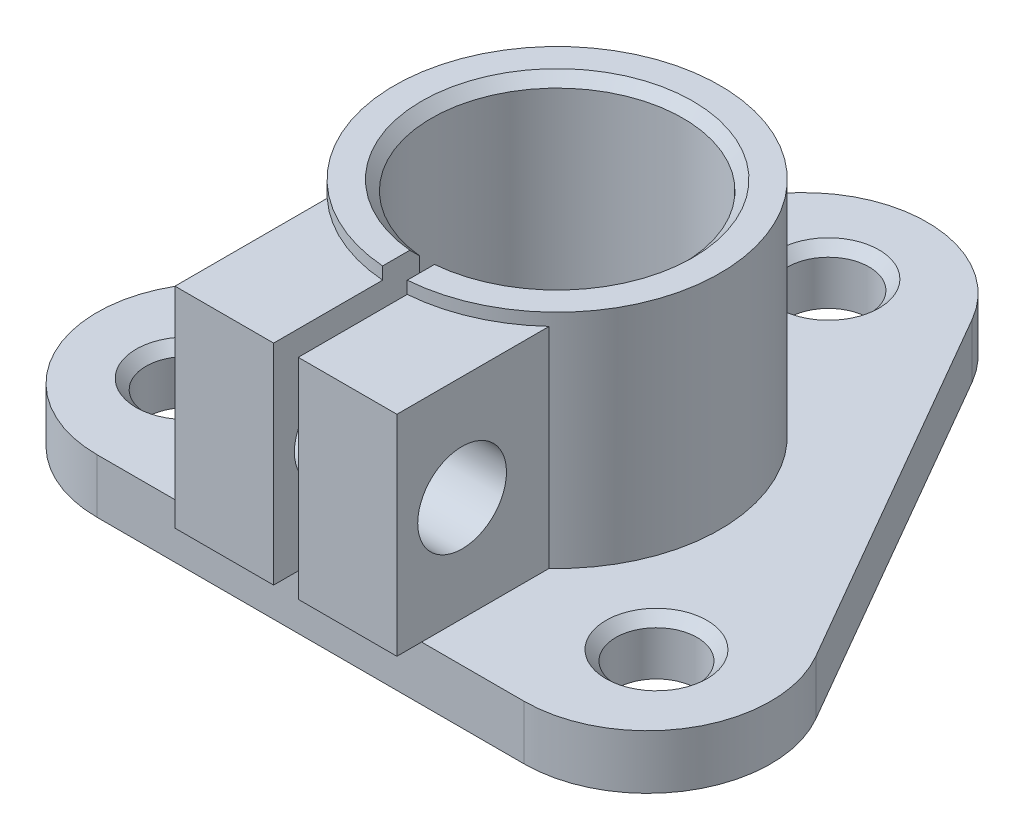
from build123d import *

# Parameters (mm, degrees)
EXTRUDE_1_DEPTH             = 2.2
CUT_EXTRUDE_2_REACH         = 28.549
SKETCH_4_R                  = 1.65
CUT_EXTRUDE_3_REACH         = 28.549
SKETCH_2_R                  = 5.1
EXTRUDE_START               = 9
SKETCH_5_R                  = 6.6
SKETCH_5_R_2                = 5.1
EXTRUDE_1_2_DEPTH           = 9
FILLET_1_R                  = 5
SKETCH_6_W                  = 1
SKETCH_6_H                  = 6.6
CUT_EXTRUDE_1_DEPTH         = 10
EXTRUDE_2_REACH             = 32.611
SKETCH_7_W                  = 4
SKETCH_7_H                  = 8.5
EXTRUDE_2_DIRECTION_2_DEPTH = 1
SKETCH_8_R                  = 1.8
CUT_EXTRUDE_4_DEPTH         = 27.081311829
CHAMFER_1_SIZE              = 0.4


with BuildPart() as part:
    # 草图1 → Extrude 1 (new body)
    with BuildSketch(Plane(origin=(0, 0, 0), x_dir=(1, 0, 0), z_dir=(0, 1, 0))):
        Polygon((17.320508076, -10), (0, 20), (-17.320508076, -10), align=None)
    extrude(amount=EXTRUDE_1_DEPTH)

    # 草图4 → 切除-拉伸2 (cut, up to next)
    with BuildSketch(Plane(origin=(0, 2.2, 0), x_dir=(1, 0, 0), z_dir=(0, 1, 0)), mode=Mode.PRIVATE) as cut_extrude_2_sk1:
        with Locations((0, 11)):
            Circle(SKETCH_4_R)
    cut_extrude_2_tool1 = extrude(cut_extrude_2_sk1.sketch, amount=-CUT_EXTRUDE_2_REACH, mode=Mode.PRIVATE) & part.part
    # 草图4 → 切除-拉伸2 (cut, up to next)
    with BuildSketch(Plane(origin=(0, 2.2, 0), x_dir=(1, 0, 0), z_dir=(0, 1, 0)), mode=Mode.PRIVATE) as cut_extrude_2_sk2:
        with Locations((9.526279442, -5.5)):
            Circle(SKETCH_4_R)
    cut_extrude_2_tool2 = extrude(cut_extrude_2_sk2.sketch, amount=-CUT_EXTRUDE_2_REACH, mode=Mode.PRIVATE) & part.part
    # 草图4 → 切除-拉伸2 (cut, up to next)
    with BuildSketch(Plane(origin=(0, 2.2, 0), x_dir=(1, 0, 0), z_dir=(0, 1, 0)), mode=Mode.PRIVATE) as cut_extrude_2_sk3:
        with Locations((-9.526279442, -5.5)):
            Circle(SKETCH_4_R)
    cut_extrude_2_tool3 = extrude(cut_extrude_2_sk3.sketch, amount=-CUT_EXTRUDE_2_REACH, mode=Mode.PRIVATE) & part.part
    add(cut_extrude_2_tool1.solids().sort_by_distance((0, 2.2, -11))[0], mode=Mode.SUBTRACT)
    add(cut_extrude_2_tool2.solids().sort_by_distance((9.526279, 2.2, 5.5))[0], mode=Mode.SUBTRACT)
    add(cut_extrude_2_tool3.solids().sort_by_distance((-9.526279, 2.2, 5.5))[0], mode=Mode.SUBTRACT)

    # 草图2 → 切除-拉伸3 (cut, up to next)
    with BuildSketch(Plane(origin=(0, 2.2, 0), x_dir=(1, 0, 0), z_dir=(0, 1, 0)), mode=Mode.PRIVATE) as cut_extrude_3_sk1:
        Circle(SKETCH_2_R)
    cut_extrude_3_tool1 = extrude(cut_extrude_3_sk1.sketch, amount=-CUT_EXTRUDE_3_REACH, mode=Mode.PRIVATE) & part.part
    add(cut_extrude_3_tool1.solids().sort_by_distance((0, 2.2, 0))[0], mode=Mode.SUBTRACT)

    # 草图5 → Extrude 1 2 (add)
    with BuildSketch(Plane(origin=(0, 2.2, 0), x_dir=(1, 0, 0), z_dir=(0, 1, 0)).offset(EXTRUDE_START)):
        Circle(SKETCH_5_R)
        Circle(SKETCH_5_R_2, mode=Mode.SUBTRACT)
    extrude(amount=-EXTRUDE_1_2_DEPTH)

    # 圆角1
    fillet_1_edges = [part.edges().sort_by_distance(p)[0] for p in [
        (17.320508076, 1.1, 10),
        (-17.320508076, 1.1, 10),
        (0, 1.1, -20),
    ]]
    fillet(fillet_1_edges, radius=FILLET_1_R)

    # 草图6 → 切除-拉伸-薄壁1 (cut)
    with BuildSketch(Plane(origin=(0, 11.2, 0), x_dir=(1, 0, 0), z_dir=(0, 1, 0))):
        with Locations((0, -3.3)):
            Rectangle(SKETCH_6_W, SKETCH_6_H)
    extrude(amount=-CUT_EXTRUDE_1_DEPTH, mode=Mode.SUBTRACT)

    # 草图7 → 凸台-拉伸2 (add, up to next)
    with BuildSketch(Plane.XY.offset(10), mode=Mode.PRIVATE) as extrude_2_sk1:
        with Locations((-2.5, 6.45)):
            Rectangle(SKETCH_7_W, SKETCH_7_H)
    extrude_2_tool1 = extrude(extrude_2_sk1.sketch, amount=-EXTRUDE_2_REACH, mode=Mode.PRIVATE) - part.part
    # 草图7 → 凸台-拉伸2 (add, up to next)
    with BuildSketch(Plane.XY.offset(10), mode=Mode.PRIVATE) as extrude_2_sk2:
        with Locations((2.5, 6.45)):
            Rectangle(SKETCH_7_W, SKETCH_7_H)
    extrude_2_tool2 = extrude(extrude_2_sk2.sketch, amount=-EXTRUDE_2_REACH, mode=Mode.PRIVATE) - part.part
    add(extrude_2_tool1.solids().sort_by_distance((-2.5, 6.45, 10))[0])
    add(extrude_2_tool2.solids().sort_by_distance((2.5, 6.45, 10))[0])

    # 草图7 → 凸台-拉伸2 direction 2 (add)
    with BuildSketch(Plane.XY.offset(10)):
        with Locations((-2.5, 6.45)):
            Rectangle(SKETCH_7_W, SKETCH_7_H)
        with Locations((2.5, 6.45)):
            Rectangle(SKETCH_7_W, SKETCH_7_H)
    extrude(amount=EXTRUDE_2_DIRECTION_2_DEPTH)

    # 草图8 → 切除-拉伸4 (cut, through all)
    with BuildSketch(Plane.ZY.offset(4.5)):
        with Locations((8.357017971, 6.45)):
            Circle(SKETCH_8_R)
    extrude(amount=-CUT_EXTRUDE_4_DEPTH, mode=Mode.SUBTRACT)

    # 倒角1
    chamfer_1_edges = [part.edges().sort_by_distance(p)[0] for p in [
        (-3.424908758, 11.2, -3.778888726),
        (-1.65, 2.2, -11),
        (7.876279442, 2.2, 5.5),
        (-11.176279442, 2.2, 5.5),
    ]]
    chamfer(chamfer_1_edges, length=CHAMFER_1_SIZE)


solid = part.part
